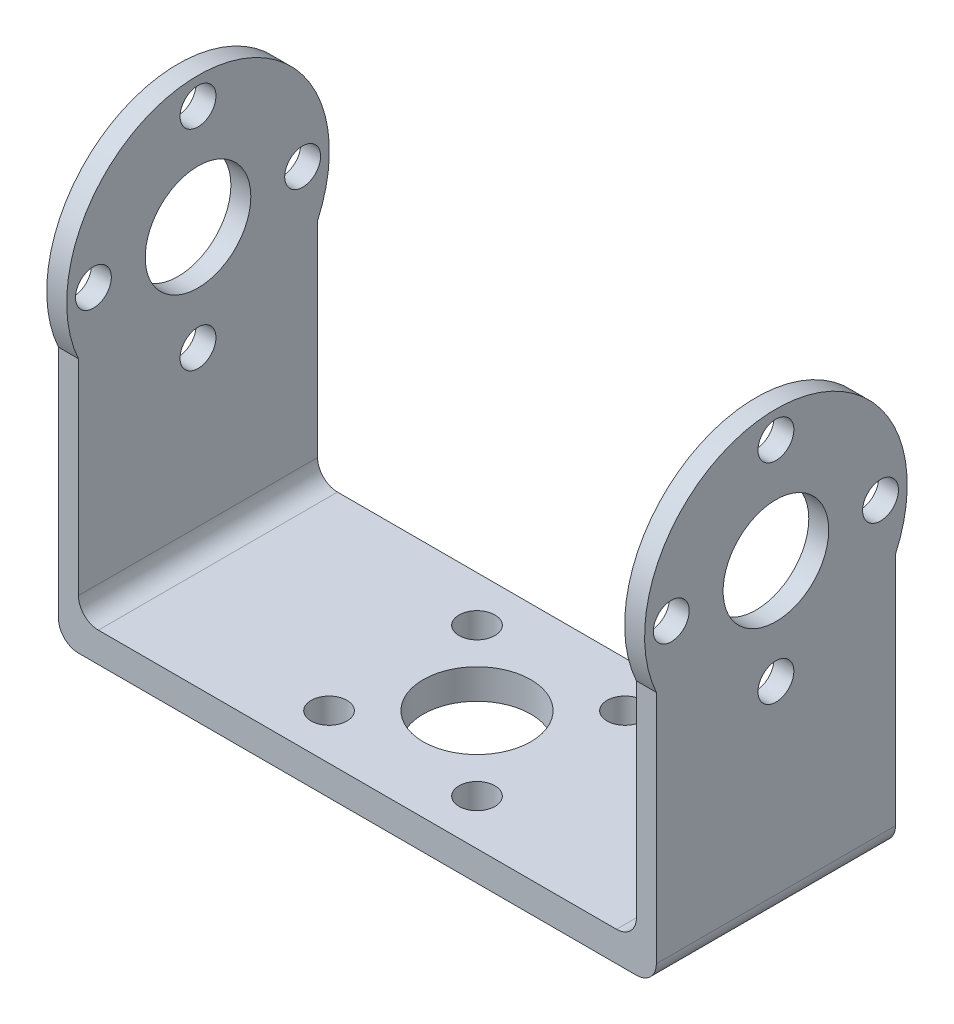
from build123d import *

# Parameters (mm, degrees)
CROQUIS1_W              = 60
CROQUIS1_H              = 24
SALIENTE_EXTRUIR1_DEPTH = 2
CROQUIS3_R              = 5.3
SALIENTE_EXTRUIR2_DEPTH = 2
CORTAR_EXTRUIR1_REACH   = 77.111
CROQUIS5_R              = 1.8
CROQUIS6_W              = 60
CROQUIS6_H              = 24
SALIENTE_EXTRUIR3_DEPTH = 1
CORTAR_EXTRUIR2_REACH   = 57.037
CROQUIS7_R              = 5.4
CROQUIS7_R_2            = 1.8
REDONDEO1_R             = 2


with BuildPart() as part:
    # Croquis1 → Saliente-Extruir1 (new body)
    with BuildSketch(Plane(origin=(0, 0, 0), x_dir=(1, 0, 0), z_dir=(0, 1, 0))):
        Rectangle(CROQUIS1_W, CROQUIS1_H)
    extrude(amount=SALIENTE_EXTRUIR1_DEPTH)

    # Croquis3 → Saliente-Extruir2 (add)
    with BuildSketch(Plane(origin=(30, 0, 0), x_dir=(0, 0, -1), z_dir=(1, 0, 0))):
        with BuildLine():
            Line((12, 2), (-12, 2))
            Line((-12, 2), (-12, 24.589091819))
            ThreePointArc((-12, 24.589091819), (0, 43.22), (12, 24.589091819))
            Line((12, 24.589091819), (12, 2))
        make_face()
        with Locations((0, 30.04)):
            Circle(CROQUIS3_R, mode=Mode.SUBTRACT)
    saliente_extruir2 = extrude(amount=-SALIENTE_EXTRUIR2_DEPTH)

    # Croquis5 → Cortar-Extruir1 (cut, up to next)
    with BuildSketch(Plane(origin=(30, 0, 0), x_dir=(0, 0, -1), z_dir=(1, 0, 0)), mode=Mode.PRIVATE) as cortar_extruir1_sk1:
        with Locations((0, 40.54)):
            Circle(CROQUIS5_R)
    cortar_extruir1_tool1 = extrude(cortar_extruir1_sk1.sketch, amount=-CORTAR_EXTRUIR1_REACH, mode=Mode.PRIVATE) & part.part
    # Croquis5 → Cortar-Extruir1 (cut, up to next)
    with BuildSketch(Plane(origin=(30, 0, 0), x_dir=(0, 0, -1), z_dir=(1, 0, 0)), mode=Mode.PRIVATE) as cortar_extruir1_sk2:
        with Locations((10.5, 30.04)):
            Circle(CROQUIS5_R)
    cortar_extruir1_tool2 = extrude(cortar_extruir1_sk2.sketch, amount=-CORTAR_EXTRUIR1_REACH, mode=Mode.PRIVATE) & part.part
    # Croquis5 → Cortar-Extruir1 (cut, up to next)
    with BuildSketch(Plane(origin=(30, 0, 0), x_dir=(0, 0, -1), z_dir=(1, 0, 0)), mode=Mode.PRIVATE) as cortar_extruir1_sk3:
        with Locations((0, 19.54)):
            Circle(CROQUIS5_R)
    cortar_extruir1_tool3 = extrude(cortar_extruir1_sk3.sketch, amount=-CORTAR_EXTRUIR1_REACH, mode=Mode.PRIVATE) & part.part
    # Croquis5 → Cortar-Extruir1 (cut, up to next)
    with BuildSketch(Plane(origin=(30, 0, 0), x_dir=(0, 0, -1), z_dir=(1, 0, 0)), mode=Mode.PRIVATE) as cortar_extruir1_sk4:
        with Locations((-10.5, 30.04)):
            Circle(CROQUIS5_R)
    cortar_extruir1_tool4 = extrude(cortar_extruir1_sk4.sketch, amount=-CORTAR_EXTRUIR1_REACH, mode=Mode.PRIVATE) & part.part
    cortar_extruir1_1 = cortar_extruir1_tool1.solids().sort_by_distance((30, 40.54, 0))[0]
    add(cortar_extruir1_1, mode=Mode.SUBTRACT)
    cortar_extruir1_2 = cortar_extruir1_tool2.solids().sort_by_distance((30, 30.04, -10.5))[0]
    add(cortar_extruir1_2, mode=Mode.SUBTRACT)
    cortar_extruir1_3 = cortar_extruir1_tool3.solids().sort_by_distance((30, 19.54, 0))[0]
    add(cortar_extruir1_3, mode=Mode.SUBTRACT)
    cortar_extruir1_4 = cortar_extruir1_tool4.solids().sort_by_distance((30, 30.04, 10.5))[0]
    add(cortar_extruir1_4, mode=Mode.SUBTRACT)
    cortar_extruir1 = cortar_extruir1_1 + cortar_extruir1_2 + cortar_extruir1_3 + cortar_extruir1_4  # Cortar-Extruir1 as one shape, for the pattern or mirror that repeats it

    # Simetría1: Saliente-Extruir2, Cortar-Extruir1 across plane
    add(saliente_extruir2.mirror(Plane(origin=(0, 0, 0), x_dir=(0, 0, 1), z_dir=(1, 0, 0))))
    add(cortar_extruir1.mirror(Plane(origin=(0, 0, 0), x_dir=(0, 0, 1), z_dir=(1, 0, 0))), mode=Mode.SUBTRACT)

    # Croquis6 → Saliente-Extruir3 (add)
    with BuildSketch(Plane.XZ):
        Rectangle(CROQUIS6_W, CROQUIS6_H)
    extrude(amount=SALIENTE_EXTRUIR3_DEPTH)

    # Croquis7 → Cortar-Extruir2 (cut, up to next)
    with BuildSketch(Plane.XZ.offset(1), mode=Mode.PRIVATE) as cortar_extruir2_sk1:
        Circle(CROQUIS7_R)
    cortar_extruir2_tool1 = extrude(cortar_extruir2_sk1.sketch, amount=-CORTAR_EXTRUIR2_REACH, mode=Mode.PRIVATE) & part.part
    # Croquis7 → Cortar-Extruir2 (cut, up to next)
    with BuildSketch(Plane.XZ.offset(1), mode=Mode.PRIVATE) as cortar_extruir2_sk2:
        with Locations((7.424621202, -7.424621202)):
            Circle(CROQUIS7_R_2)
    cortar_extruir2_tool2 = extrude(cortar_extruir2_sk2.sketch, amount=-CORTAR_EXTRUIR2_REACH, mode=Mode.PRIVATE) & part.part
    # Croquis7 → Cortar-Extruir2 (cut, up to next)
    with BuildSketch(Plane.XZ.offset(1), mode=Mode.PRIVATE) as cortar_extruir2_sk3:
        with Locations((-7.423621202, -7.423621202)):
            Circle(CROQUIS7_R_2)
    cortar_extruir2_tool3 = extrude(cortar_extruir2_sk3.sketch, amount=-CORTAR_EXTRUIR2_REACH, mode=Mode.PRIVATE) & part.part
    # Croquis7 → Cortar-Extruir2 (cut, up to next)
    with BuildSketch(Plane.XZ.offset(1), mode=Mode.PRIVATE) as cortar_extruir2_sk4:
        with Locations((-7.422621202, 7.424621202)):
            Circle(CROQUIS7_R_2)
    cortar_extruir2_tool4 = extrude(cortar_extruir2_sk4.sketch, amount=-CORTAR_EXTRUIR2_REACH, mode=Mode.PRIVATE) & part.part
    # Croquis7 → Cortar-Extruir2 (cut, up to next)
    with BuildSketch(Plane.XZ.offset(1), mode=Mode.PRIVATE) as cortar_extruir2_sk5:
        with Locations((7.425621202, 7.423621202)):
            Circle(CROQUIS7_R_2)
    cortar_extruir2_tool5 = extrude(cortar_extruir2_sk5.sketch, amount=-CORTAR_EXTRUIR2_REACH, mode=Mode.PRIVATE) & part.part
    add(cortar_extruir2_tool1.solids().sort_by_distance((0, -1, 0))[0], mode=Mode.SUBTRACT)
    add(cortar_extruir2_tool2.solids().sort_by_distance((7.424621, -1, -7.424621))[0], mode=Mode.SUBTRACT)
    add(cortar_extruir2_tool3.solids().sort_by_distance((-7.423621, -1, -7.423621))[0], mode=Mode.SUBTRACT)
    add(cortar_extruir2_tool4.solids().sort_by_distance((-7.422621, -1, 7.424621))[0], mode=Mode.SUBTRACT)
    add(cortar_extruir2_tool5.solids().sort_by_distance((7.425621, -1, 7.423621))[0], mode=Mode.SUBTRACT)

    # Redondeo1
    redondeo1_edges = [part.edges().sort_by_distance(p)[0] for p in [
        (-28, 2, 0),
        (28, 2, 0),
        (-30, -1, 0),
        (30, -1, 0),
    ]]
    fillet(redondeo1_edges, radius=REDONDEO1_R)


solid = part.part
